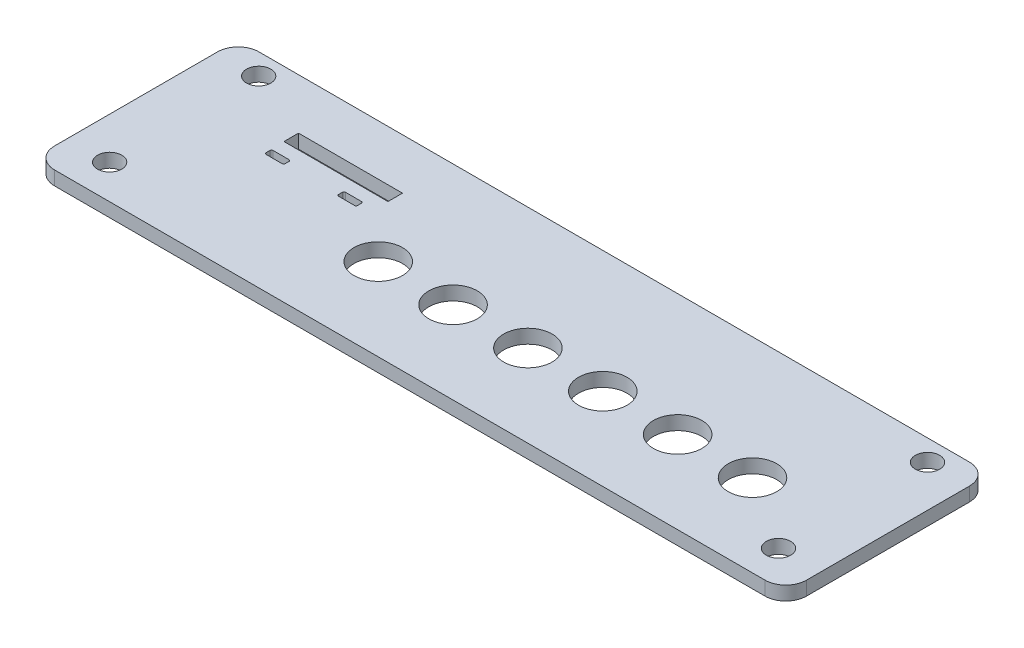
from build123d import *

# Parameters (mm, degrees)
SKETCH1_W           = 108.5
SKETCH1_H           = 29.5
BOSS_EXTRUDE1_DEPTH = 2
SKETCH2_R           = 1.75
CUT_EXTRUDE1_DEPTH  = 113.456658318
FILLET1_R           = 3
SKETCH5_R           = 3.5
SKETCH5_W           = 15
SKETCH5_H           = 2.1
SKETCH5_W_2         = 2.75
SKETCH5_H_2         = 1
CUT_EXTRUDE2_DEPTH  = 113.456658318
FILLET2_R           = 0.2


with BuildPart() as part:
    # Sketch1 → Boss-Extrude1 (new body)
    with BuildSketch(Plane(origin=(0, 0, 0), x_dir=(1, 0, 0), z_dir=(0, 1, 0))):
        with Locations((54.25, 14.75)):
            Rectangle(SKETCH1_W, SKETCH1_H)
    extrude(amount=BOSS_EXTRUDE1_DEPTH)

    # Sketch2 → Cut-Extrude1 (cut, through all)
    with BuildSketch(Plane(origin=(0, 2, 0), x_dir=(1, 0, 0), z_dir=(0, 1, 0))):
        with Locations((6, 26.45)):
            Circle(SKETCH2_R)
        with Locations((6, 4.95)):
            Circle(SKETCH2_R)
        with Locations((102.5, 4.95)):
            Circle(SKETCH2_R)
        with Locations((102.5, 26.45)):
            Circle(SKETCH2_R)
    extrude(amount=-CUT_EXTRUDE1_DEPTH, mode=Mode.SUBTRACT)

    # Fillet1
    fillet1_edges = [part.edges().sort_by_distance(p)[0] for p in [
        (108.5, 1, 0),
        (108.5, 1, -29.5),
        (0, 1, 0),
        (0, 1, -29.5),
    ]]
    fillet(fillet1_edges, radius=FILLET1_R)

    # Sketch5 → Cut-Extrude2 (cut, through all)
    with BuildSketch(Plane(origin=(0, 2, 0), x_dir=(1, 0, 0), z_dir=(0, 1, 0))):
        with Locations((91.8, 11.9)):
            Circle(SKETCH5_R)
        with Locations((81, 11.9)):
            Circle(SKETCH5_R)
        with Locations((70.2, 11.9)):
            Circle(SKETCH5_R)
        with Locations((59.4, 11.9)):
            Circle(SKETCH5_R)
        with Locations((48.6, 11.9)):
            Circle(SKETCH5_R)
        with Locations((37.8, 11.9)):
            Circle(SKETCH5_R)
        with Locations((23.5, 21.15)):
            Rectangle(SKETCH5_W, SKETCH5_H)
        with Locations((17.475, 17.7)):
            Rectangle(SKETCH5_W_2, SKETCH5_H_2)
        with Locations((27.925, 17.7)):
            Rectangle(SKETCH5_W_2, SKETCH5_H_2)
    extrude(amount=-CUT_EXTRUDE2_DEPTH, mode=Mode.SUBTRACT)

    # Fillet2
    fillet2_edges = [part.edges().sort_by_distance(p)[0] for p in [
        (26.55, 1, -18.2),
        (18.85, 1, -18.2),
        (29.3, 1, -18.2),
        (29.3, 1, -17.2),
        (18.85, 1, -17.2),
        (26.55, 1, -17.2),
        (16.1, 1, -17.2),
        (16.1, 1, -18.2),
    ]]
    fillet(fillet2_edges, radius=FILLET2_R)


solid = part.part
